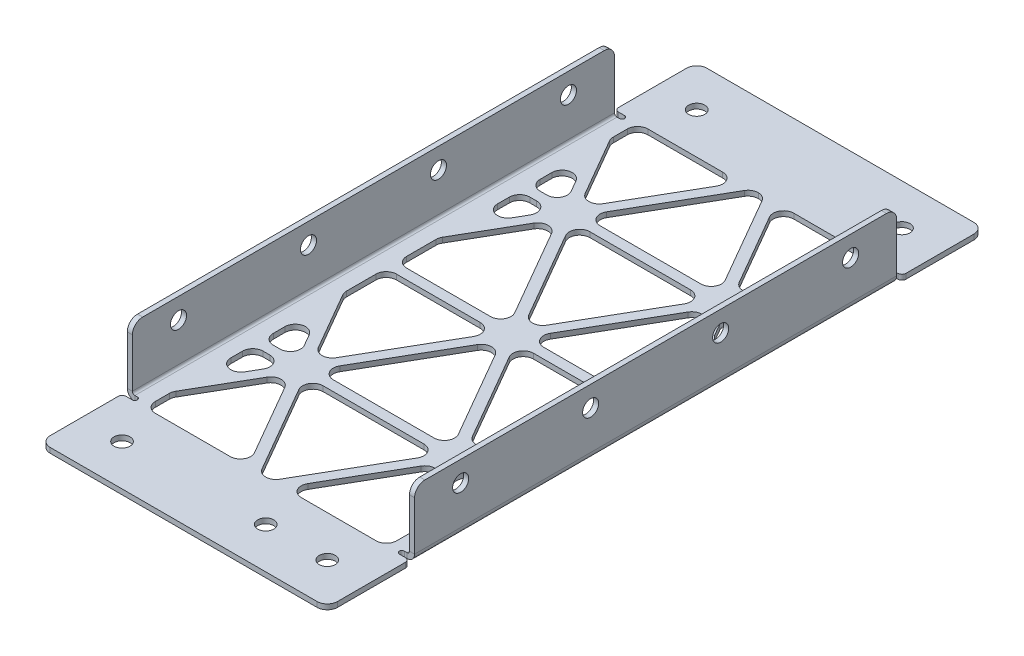
from build123d import *

# Parameters (mm, degrees)
BASE_FLANGE1_START     = -1.5875
BASE_FLANGE1_DEPTH     = 1.5875
EDGE_FLANGE1_START     = 0.762
EDGE_FLANGE1_OUTLINE_W = 1.5875
EDGE_FLANGE1_OUTLINE_H = 149.1742
EDGE_FLANGE1_DEPTH     = 18.288
EDGE_FLANGE1_START_2   = -3
EDGE_FLANGE1_2_DEPTH   = 3.762
EDGE_FLANGE1_START_3   = -176.1871
EDGE_FLANGE1_3_DEPTH   = 149.1742
EDGE_FLANGE1_4_DEPTH   = 149.1742
SKETCH22_R             = 2.4892
CUT_EXTRUDE1_DEPTH     = 223.612561416
CUT_EXTRUDE2_REACH     = 224.754
SKETCH24_R             = 2.4892
FILLET2_R              = 3.175
FILLET3_R              = 1.27
CUT_EXTRUDE3_REACH     = 224.613
SKETCH25_W             = 74.676
SKETCH25_H             = 152.4
SKETCH2_W              = 74.676
SKETCH2_H              = 3.175
EXTRUDE_THIN1_DEPTH    = 1.5875
SURFACECUT4_START      = -1.5875
SURFACECUT4_DEPTH      = 1.5875
FILLET4_R              = 3.175


with BuildPart() as part:
    # Base-Flange1: read off the stored shape, not the designer's step
    # Base-Flange1 outline → Base-Flange1 (new body)
    with BuildSketch(Plane(origin=(0, 0, 0), x_dir=(1, 0, 0), z_dir=(0, 1, 0)).offset(BASE_FLANGE1_START)):
        with BuildLine():
            ThreePointArc((0, 27.0129), (0.0254, 26.9875), (0, 26.9621))
            Line((0, 26.9621), (0, 0))
            Line((0, 0), (88.9, 0))
            Line((88.9, 0), (88.9, 26.9621))
            ThreePointArc((88.9, 26.9621), (88.8746, 26.9875), (88.9, 27.0129))
            Line((88.9, 27.0129), (88.9, 176.1871))
            ThreePointArc((88.9, 176.1871), (88.8746, 176.2125), (88.9, 176.2379))
            Line((88.9, 176.2379), (88.9, 203.2))
            Line((88.9, 203.2), (0, 203.2))
            Line((0, 203.2), (0, 176.2379))
            ThreePointArc((0, 176.2379), (0.0254, 176.2125), (0, 176.1871))
            Line((0, 176.1871), (0, 27.0129))
        make_face()
    extrude(amount=BASE_FLANGE1_DEPTH)

    # Edge-Flange1 2 outline → Edge-Flange1 2 (cut)
    with BuildSketch(Plane(origin=(0, 0, 0), x_dir=(1, 0, 0), z_dir=(0, 1, 0)).offset(EDGE_FLANGE1_START_2)):
        with BuildLine():
            ThreePointArc((0, 176.2379), (0.0254, 176.2125), (0, 176.1871))
            Line((0, 176.1871), (3.14325, 176.1871))
            ThreePointArc((3.14325, 176.1871), (3.937, 176.98085), (3.14325, 177.7746))
            Line((3.14325, 177.7746), (0, 177.7746))
            Line((0, 177.7746), (0, 176.2379))
        make_face()
        with BuildLine():
            ThreePointArc((3.14325, 25.4254), (3.937, 26.21915), (3.14325, 27.0129))
            Line((3.14325, 27.0129), (0, 27.0129))
            ThreePointArc((0, 27.0129), (0.0254, 26.9875), (0, 26.9621))
            Line((0, 26.9621), (0, 25.4254))
            Line((0, 25.4254), (3.14325, 25.4254))
        make_face()
        with BuildLine():
            Line((85.75675, 176.1871), (88.9, 176.1871))
            ThreePointArc((88.9, 176.1871), (88.8746, 176.2125), (88.9, 176.2379))
            Line((88.9, 176.2379), (88.9, 177.7746))
            Line((88.9, 177.7746), (85.75675, 177.7746))
            ThreePointArc((85.75675, 177.7746), (84.963, 176.98085), (85.75675, 176.1871))
        make_face()
        with BuildLine():
            Line((88.9, 27.0129), (85.75675, 27.0129))
            ThreePointArc((85.75675, 27.0129), (84.963, 26.21915), (85.75675, 25.4254))
            Line((85.75675, 25.4254), (88.9, 25.4254))
            Line((88.9, 25.4254), (88.9, 26.9621))
            ThreePointArc((88.9, 26.9621), (88.8746, 26.9875), (88.9, 27.0129))
        make_face()
    extrude(amount=EDGE_FLANGE1_2_DEPTH, mode=Mode.SUBTRACT)

    # Edge-Flange1 3 outline → Edge-Flange1 3 (cut)
    with BuildSketch(Plane.XY.offset(EDGE_FLANGE1_START_3)):
        with BuildLine():
            Line((88.9, 0), (88.773, 0))
            ThreePointArc((88.773, 0), (87.916119136, -1.14986679), (86.5505, -1.5875))
            Line((86.5505, -1.5875), (88.9, -1.5875))
            Line((88.9, -1.5875), (88.9, 0))
        make_face()
        with BuildLine():
            Line((0, -1.5875), (2.3495, -1.5875))
            ThreePointArc((2.3495, -1.5875), (0.983880864, -1.14986679), (0.127, 0))
            Line((0.127, 0), (0, 0))
            Line((0, 0), (0, -1.5875))
        make_face()
    extrude(amount=EDGE_FLANGE1_3_DEPTH, mode=Mode.SUBTRACT)



with BuildPart() as body_2:
    # Edge-Flange1: read off the stored shape, not the designer's step
    # Edge-Flange1 outline → Edge-Flange1 (new body)
    with BuildSketch(Plane(origin=(0, 0, 0), x_dir=(1, 0, 0), z_dir=(0, 1, 0)).offset(EDGE_FLANGE1_START)):
        with Locations((88.10625, 101.6)):
            Rectangle(EDGE_FLANGE1_OUTLINE_W, EDGE_FLANGE1_OUTLINE_H)
        with Locations((0.79375, 101.6)):
            Rectangle(EDGE_FLANGE1_OUTLINE_W, EDGE_FLANGE1_OUTLINE_H)
    extrude(amount=EDGE_FLANGE1_DEPTH)


with BuildPart() as part_1:
    add(part.part)

    add(body_2.part)  # Edge-Flange1 4 merges body 2
    # Edge-Flange1 4 outline → Edge-Flange1 4 (add)
    with BuildSketch(Plane.XY.offset(EDGE_FLANGE1_START_3)):
        with BuildLine():
            ThreePointArc((88.773, 0), (88.868032524, 0.375744579), (88.9, 0.762))
            Line((88.9, 0.762), (87.3125, 0.762))
            ThreePointArc((87.3125, 0.762), (87.089315367, 0.223184633), (86.5505, 0))
            Line((86.5505, 0), (88.773, 0))
        make_face()
        with BuildLine():
            Line((0.127, 0), (2.3495, 0))
            ThreePointArc((2.3495, 0), (1.810684633, 0.223184633), (1.5875, 0.762))
            Line((1.5875, 0.762), (0, 0.762))
            ThreePointArc((0, 0.762), (0.031967476, 0.375744579), (0.127, 0))
        make_face()
    extrude(amount=EDGE_FLANGE1_4_DEPTH)

    # Sketch22 → Cut-Extrude1 (cut, through all)
    with BuildSketch(Plane(origin=(88.9, 0, 0), x_dir=(0, 0, -1), z_dir=(1, 0, 0))):
        with Locations(Location((41.275, 12.7, 0), (0, 0, 90))):
            Circle(SKETCH22_R)
        with Locations(Location((81.491666667, 12.7, 0), (0, 0, 90))):
            Circle(SKETCH22_R)
        with Locations(Location((121.708333333, 12.7, 0), (0, 0, 90))):
            Circle(SKETCH22_R)
        with Locations(Location((161.925, 12.7, 0), (0, 0, 90))):
            Circle(SKETCH22_R)
    extrude(amount=-CUT_EXTRUDE1_DEPTH, mode=Mode.SUBTRACT)

    # Sketch24 → Cut-Extrude2 (cut, up to next)
    with BuildSketch(Plane.XZ.offset(1.5875), mode=Mode.PRIVATE) as cut_extrude2_sk1:
        with Locations(Location((12.7, -12.7, 0), (0, 0, 270))):
            Circle(SKETCH24_R)
    cut_extrude2_tool1 = extrude(cut_extrude2_sk1.sketch, amount=-CUT_EXTRUDE2_REACH, mode=Mode.PRIVATE) & part_1.part
    # Sketch24 → Cut-Extrude2 (cut, up to next)
    with BuildSketch(Plane.XZ.offset(1.5875), mode=Mode.PRIVATE) as cut_extrude2_sk2:
        with Locations(Location((76.2, -12.7, 0), (0, 0, 270))):
            Circle(SKETCH24_R)
    cut_extrude2_tool2 = extrude(cut_extrude2_sk2.sketch, amount=-CUT_EXTRUDE2_REACH, mode=Mode.PRIVATE) & part_1.part
    # Sketch24 → Cut-Extrude2 (cut, up to next)
    with BuildSketch(Plane.XZ.offset(1.5875), mode=Mode.PRIVATE) as cut_extrude2_sk3:
        with Locations(Location((57.15, -12.7, 0), (0, 0, 270))):
            Circle(SKETCH24_R)
    cut_extrude2_tool3 = extrude(cut_extrude2_sk3.sketch, amount=-CUT_EXTRUDE2_REACH, mode=Mode.PRIVATE) & part_1.part
    # Sketch24 → Cut-Extrude2 (cut, up to next)
    with BuildSketch(Plane.XZ.offset(1.5875), mode=Mode.PRIVATE) as cut_extrude2_sk4:
        with Locations(Location((76.2, -190.5, 0), (0, 0, 90))):
            Circle(SKETCH24_R)
    cut_extrude2_tool4 = extrude(cut_extrude2_sk4.sketch, amount=-CUT_EXTRUDE2_REACH, mode=Mode.PRIVATE) & part_1.part
    # Sketch24 → Cut-Extrude2 (cut, up to next)
    with BuildSketch(Plane.XZ.offset(1.5875), mode=Mode.PRIVATE) as cut_extrude2_sk5:
        with Locations(Location((12.7, -190.5, 0), (0, 0, 90))):
            Circle(SKETCH24_R)
    cut_extrude2_tool5 = extrude(cut_extrude2_sk5.sketch, amount=-CUT_EXTRUDE2_REACH, mode=Mode.PRIVATE) & part_1.part
    add(cut_extrude2_tool1.solids().sort_by_distance((12.7, -1.5875, -12.7))[0], mode=Mode.SUBTRACT)
    add(cut_extrude2_tool2.solids().sort_by_distance((76.2, -1.5875, -12.7))[0], mode=Mode.SUBTRACT)
    add(cut_extrude2_tool3.solids().sort_by_distance((57.15, -1.5875, -12.7))[0], mode=Mode.SUBTRACT)
    add(cut_extrude2_tool4.solids().sort_by_distance((76.2, -1.5875, -190.5))[0], mode=Mode.SUBTRACT)
    add(cut_extrude2_tool5.solids().sort_by_distance((12.7, -1.5875, -190.5))[0], mode=Mode.SUBTRACT)

    # Fillet2
    fillet2_edges = [part_1.edges().sort_by_distance(p)[0] for p in [
        (88.10625, 19.05, -27.0129),
        (88.10625, 19.05, -176.1871),
        (0.79375, 19.05, -176.1871),
        (0.79375, 19.05, -27.0129),
        (0, -0.79375, -203.2),
        (88.9, -0.79375, -203.2),
        (88.9, -0.79375, 0),
        (0, -0.79375, 0),
    ]]
    fillet(fillet2_edges, radius=FILLET2_R)

    # Fillet3
    fillet3_edges = [part_1.edges().sort_by_distance(p)[0] for p in [
        (88.9, -0.79375, -25.4254),
        (88.9, -0.79375, -177.7746),
        (0, -0.79375, -177.7746),
        (0, -0.79375, -25.4254),
    ]]
    fillet(fillet3_edges, radius=FILLET3_R)

    # Sketch25 → Cut-Extrude3 (cut, up to next)
    with BuildSketch(Plane(origin=(0, 0, 0), x_dir=(1, 0, 0), z_dir=(0, 1, 0)), mode=Mode.PRIVATE) as cut_extrude3_sk1:
        with Locations((44.45, 101.6)):
            Rectangle(SKETCH25_W, SKETCH25_H)
    cut_extrude3_tool1 = extrude(cut_extrude3_sk1.sketch, amount=-CUT_EXTRUDE3_REACH, mode=Mode.PRIVATE) & part_1.part
    add(cut_extrude3_tool1.solids().sort_by_distance((44.45, 0, -101.6))[0], mode=Mode.SUBTRACT)

    # Sketch2 → Extrude-Thin1 (add)
    with BuildSketch(Plane(origin=(0, 0, 0), x_dir=(1, 0, 0), z_dir=(0, 1, 0))):
        with Locations((44.45, 101.6)):
            Rectangle(SKETCH2_W, SKETCH2_H)
        Polygon((2.562184671, 170.976824367), (83.588184671, 30.635675633), (86.337815329, 32.223175633), (5.311815329, 172.564324367), align=None)
        Polygon((5.311815329, 30.635675633), (86.337815329, 170.976824367), (83.588184671, 172.564324367), (2.562184671, 32.223175633), align=None)
        with Locations((44.45, 60.325)):
            Rectangle(SKETCH2_W, SKETCH2_H)
        with Locations((44.45, 19.05)):
            Rectangle(SKETCH2_W, SKETCH2_H)
        Polygon((2.562184671, 88.426824367), (83.588184671, -51.914324367), (86.337815329, -50.326824367), (5.311815329, 90.014324367), align=None)
        Polygon((5.311815329, -51.914324367), (86.337815329, 88.426824367), (83.588184671, 90.014324367), (2.562184671, -50.326824367), align=None)
        Polygon((2.562184671, 253.526824367), (83.588184671, 113.185675633), (86.337815329, 114.773175633), (5.311815329, 255.114324367), align=None)
        Polygon((5.311815329, 113.185675633), (86.337815329, 253.526824367), (83.588184671, 255.114324367), (2.562184671, 114.773175633), align=None)
        with Locations((44.45, 184.15)):
            Rectangle(SKETCH2_W, SKETCH2_H)
        with Locations((44.45, 142.875)):
            Rectangle(SKETCH2_W, SKETCH2_H)
    extrude(amount=-EXTRUDE_THIN1_DEPTH)

    # SurfaceCut4: read off the stored shape, not the designer's step
    # SurfaceCut4 outline → SurfaceCut4 (cut)
    with BuildSketch(Plane(origin=(0, 0, 0), x_dir=(1, 0, 0), z_dir=(0, 1, 0)).offset(SURFACECUT4_START)):
        Polygon((5.311815329, 255.114324367), (2.562184671, 253.526824367), (31.618390267, 203.2), (35.284564477, 203.2), align=None)
        Polygon((83.588184671, 255.114324367), (53.615435523, 203.2), (57.281609733, 203.2), (86.337815329, 253.526824367), align=None)
        Polygon((57.281609733, 0), (53.615435523, 0), (83.588184671, -51.914324367), (86.337815329, -50.326824367), align=None)
        Polygon((5.311815329, -51.914324367), (35.284564477, 0), (31.618390267, 0), (2.562184671, -50.326824367), align=None)
    extrude(amount=SURFACECUT4_DEPTH, mode=Mode.SUBTRACT)

    # Fillet4
    fillet4_edges = [part_1.edges().sort_by_distance(p)[0] for p in [
        (81.788, -0.79375, -61.9125),
        (81.788, -0.79375, -144.4625),
        (81.788, -0.79375, -103.1875),
        (7.112, -0.79375, -163.096313053),
        (7.112, -0.79375, -116.303686947),
        (7.112, -0.79375, -80.546313053),
        (47.199630657, -0.79375, -103.1875),
        (41.700369343, -0.79375, -103.1875),
        (23.369498296, -0.79375, -61.9125),
        (44.45, -0.79375, -98.425),
        (65.530501704, -0.79375, -61.9125),
        (65.530501704, -0.79375, -144.4625),
        (46.283087105, -0.79375, -177.8),
        (81.788, -0.79375, -25.4),
        (23.369498296, -0.79375, -144.4625),
        (49.949261314, -0.79375, -25.4),
        (7.112, -0.79375, -33.753686947),
        (47.199630657, -0.79375, -100.0125),
        (42.616912895, -0.79375, -177.8),
        (41.700369343, -0.79375, -100.0125),
        (65.530501704, -0.79375, -141.2875),
        (17.870236982, -0.79375, -61.9125),
        (44.45, -0.79375, -104.775),
        (23.369498296, -0.79375, -141.2875),
        (17.870236982, -0.79375, -144.4625),
        (68.280132361, -0.79375, -146.05),
        (20.619867639, -0.79375, -146.05),
        (71.029763018, -0.79375, -61.9125),
        (17.870236982, -0.79375, -58.7375),
        (7.112, -0.79375, -40.103686947),
        (7.112, -0.79375, -86.896313053),
        (20.619867639, -0.79375, -63.5),
        (20.619867639, -0.79375, -139.7),
        (81.788, -0.79375, -80.546313053),
        (17.870236982, -0.79375, -141.2875),
        (7.112, -0.79375, -122.653686947),
        (7.112, -0.79375, -169.446313053),
        (71.029763018, -0.79375, -144.4625),
        (68.280132361, -0.79375, -57.15),
        (65.530501704, -0.79375, -58.7375),
        (46.283087105, -0.79375, -25.4),
        (23.369498296, -0.79375, -58.7375),
        (81.788, -0.79375, -163.096313053),
        (42.616912895, -0.79375, -25.4),
        (20.619867639, -0.79375, -57.15),
        (68.280132361, -0.79375, -63.5),
        (81.788, -0.79375, -116.303686947),
        (68.280132361, -0.79375, -139.7),
        (71.029763018, -0.79375, -141.2875),
        (81.788, -0.79375, -33.753686947),
        (71.029763018, -0.79375, -58.7375),
        (81.788, -0.79375, -58.7375),
        (81.788, -0.79375, -141.2875),
        (7.112, -0.79375, -144.4625),
        (7.112, -0.79375, -61.9125),
        (7.112, -0.79375, -103.1875),
        (81.788, -0.79375, -100.0125),
        (81.788, -0.79375, -40.103686947),
        (81.788, -0.79375, -122.653686947),
        (81.788, -0.79375, -169.446313053),
        (81.788, -0.79375, -86.896313053),
        (38.950738686, -0.79375, -25.4),
        (7.112, -0.79375, -25.4),
        (7.112, -0.79375, -177.8),
        (7.112, -0.79375, -141.2875),
        (7.112, -0.79375, -100.0125),
        (7.112, -0.79375, -58.7375),
        (49.949261314, -0.79375, -177.8),
        (81.788, -0.79375, -177.8),
        (38.950738686, -0.79375, -177.8),
    ]]
    fillet(fillet4_edges, radius=FILLET4_R - 0.0001)  # a hair under: the kernel refuses the full size


solid = part_1.part
